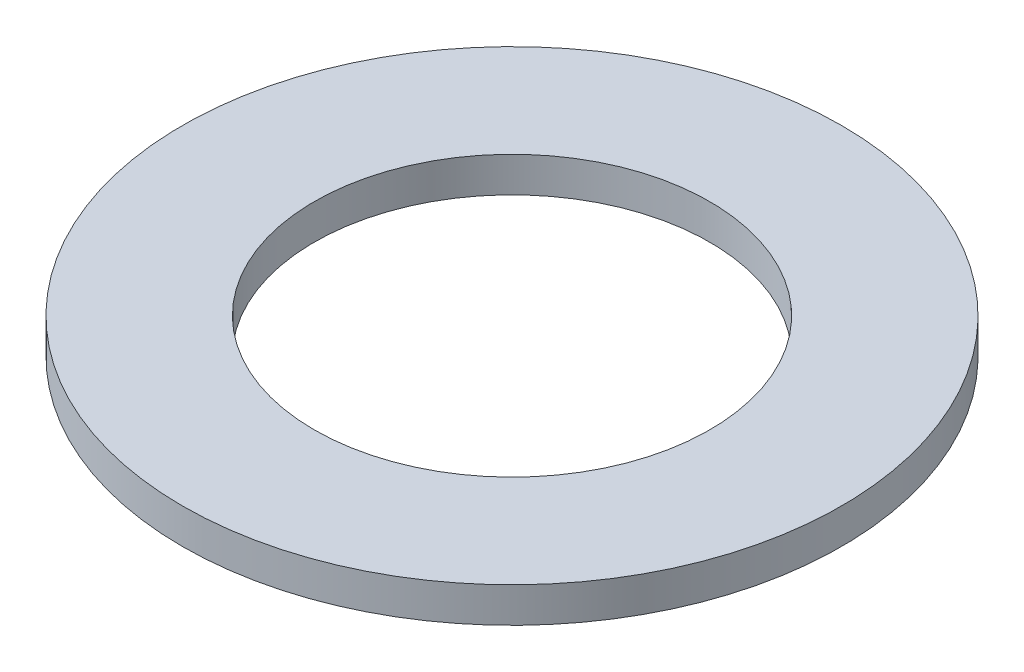
from build123d import *

# Parameters (mm, degrees)
SKETCH1_R           = 75
BOSS_EXTRUDE1_DEPTH = 8
SKETCH2_R           = 45
CUT_EXTRUDE1_DEPTH  = 107.367288205


with BuildPart() as part:
    # Sketch1 → Boss-Extrude1 (new body)
    with BuildSketch(Plane(origin=(0, 0, 0), x_dir=(1, 0, 0), z_dir=(0, 1, 0))):
        Circle(SKETCH1_R)
    extrude(amount=BOSS_EXTRUDE1_DEPTH)

    # Sketch2 → Cut-Extrude1 (cut, through all)
    with BuildSketch(Plane(origin=(0, 0, 0), x_dir=(1, 0, 0), z_dir=(0, 1, 0))):
        Circle(SKETCH2_R)
    extrude(amount=CUT_EXTRUDE1_DEPTH, mode=Mode.SUBTRACT)


solid = part.part
